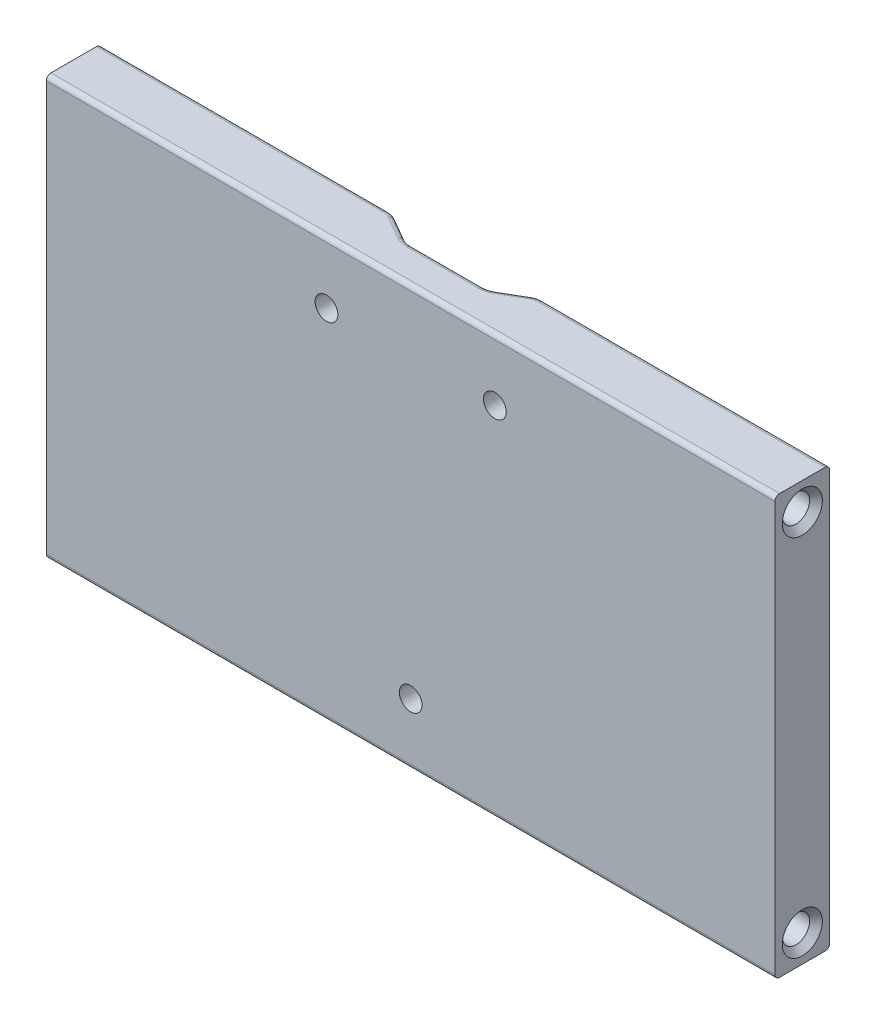
from build123d import *

# Parameters (mm, degrees)
AUFSATZ_LINEAR_AUSTRAGEN1_DEPTH         = 3
AUFSATZ_LINEAR_AUSTRAGEN1_DEPTH_BACK    = 3
SKIZZE1_W                               = 80
SKIZZE1_H                               = 46
F_3_0_3_DURCHMESSER_BOHRUNG1_AT_2_COUNT = 2
F_3_0_3_DURCHMESSER_BOHRUNG1_AT_2_PITCH = 40
SKIZZE4_W                               = 30
SKIZZE4_H                               = 43
SCHNITT_LINEAR_AUSTRAGEN1_DEPTH         = 3
VERRUNDUNG1_R                           = 3
SCHNITT_LINEAR_AUSTRAGEN2_DEPTH         = 1.5
SCHNITT_LINEAR_AUSTRAGEN2_DEPTH_BACK    = 47.238512087
SKIZZE8_R                               = 1.25
SCHNITT_LINEAR_AUSTRAGEN4_DEPTH         = 47.238512087
SCHNITT_LINEAR_AUSTRAGEN5_DEPTH         = 47.238512087
VERRUNDUNG3_R                           = 2
VERRUNDUNG2_R                           = 0.5
FASE1_SIZE                              = 0.7


with BuildPart() as part:
    # Skizze1 → Aufsatz-Linear austragen1 (new, two sides: drawn at the far end of the back side and taken through both)
    with BuildSketch(Plane.XY.offset(-AUFSATZ_LINEAR_AUSTRAGEN1_DEPTH_BACK)):
        Rectangle(SKIZZE1_W, SKIZZE1_H)
    extrude(amount=AUFSATZ_LINEAR_AUSTRAGEN1_DEPTH + AUFSATZ_LINEAR_AUSTRAGEN1_DEPTH_BACK)

    # Skizze2 → Ø3.0 (3) Durchmesser Bohrung1 (revolve, cut)
    with BuildSketch(Plane(origin=(40, -20, 0), x_dir=(0, 0, -1), z_dir=(0, 1, 0))):
        Polygon((0, 0), (0, 10.901290929), (1.5, 10), (1.5, 0), align=None)
    f_3_0_3_durchmesser_bohrung1 = revolve(axis=Axis((46.35, -20, 0), (-1, 0, 0)), mode=Mode.SUBTRACT)

    # Ø3.0 (3) Durchmesser Bohrung1 at 2: Ø3.0 (3) Durchmesser Bohrung1 ×2
    with Locations(*[(0, i * F_3_0_3_DURCHMESSER_BOHRUNG1_AT_2_PITCH, 0) for i in range(1, F_3_0_3_DURCHMESSER_BOHRUNG1_AT_2_COUNT)]):
        add(f_3_0_3_durchmesser_bohrung1, mode=Mode.SUBTRACT)

    # Spiegeln1: Ø3.0 (3) Durchmesser Bohrung1 across plane
    add(f_3_0_3_durchmesser_bohrung1.mirror(Plane(origin=(0, 0, 0), x_dir=(0, 0, 1), z_dir=(1, 0, 0))), mode=Mode.SUBTRACT)

    # Spiegeln1 copy 1 sketch → Spiegeln1 copy 1 (revolve, cut)
    with BuildSketch(Plane(origin=(-40, 20, 0), x_dir=(0, 0, -1), z_dir=(0, 1, 0))):
        Polygon((0, 0), (0, -10.901290929), (1.5, -10), (1.5, 0), align=None)
    revolve(axis=Axis((-46.35, 20, 0), (-1, 0, 0)), mode=Mode.SUBTRACT)

    # Skizze4 → Schnitt-Linear austragen1 (cut)
    with BuildSketch(Plane.XY.offset(-3)):
        Rectangle(SKIZZE4_W, SKIZZE4_H)
    extrude(amount=SCHNITT_LINEAR_AUSTRAGEN1_DEPTH, mode=Mode.SUBTRACT)

    # Verrundung1
    verrundung1_edges = [part.edges().sort_by_distance(p)[0] for p in [
        (15, 21.5, -1.5),
        (-15, 21.5, -1.5),
        (-15, -21.5, -1.5),
        (15, -21.5, -1.5),
    ]]
    fillet(verrundung1_edges, radius=VERRUNDUNG1_R)

    # Skizze5 → Schnitt-Linear austragen2 (cut, two sides: drawn at the far end of the back side and taken through both)
    with BuildSketch(Plane.XY.offset(-SCHNITT_LINEAR_AUSTRAGEN2_DEPTH_BACK)):
        with BuildLine():
            Line((37, -14.5), (37, 14.5))
            ThreePointArc((37, 14.5), (36.121320344, 16.621320344), (34, 17.5))
            Line((34, 17.5), (21, 17.5))
            ThreePointArc((21, 17.5), (18.878679656, 16.621320344), (18, 14.5))
            Line((18, 14.5), (18, -14.5))
            ThreePointArc((18, -14.5), (18.878679656, -16.621320344), (21, -17.5))
            Line((21, -17.5), (34, -17.5))
            ThreePointArc((34, -17.5), (36.121320344, -16.621320344), (37, -14.5))
        make_face()
        with BuildLine():
            Line((-34, -17.5), (-21, -17.5))
            ThreePointArc((-21, -17.5), (-18.878679656, -16.621320344), (-18, -14.5))
            Line((-18, -14.5), (-18, 14.5))
            ThreePointArc((-18, 14.5), (-18.878679656, 16.621320344), (-21, 17.5))
            Line((-21, 17.5), (-34, 17.5))
            ThreePointArc((-34, 17.5), (-36.121320344, 16.621320344), (-37, 14.5))
            Line((-37, 14.5), (-37, -14.5))
            ThreePointArc((-37, -14.5), (-36.121320344, -16.621320344), (-34, -17.5))
        make_face()
    extrude(amount=SCHNITT_LINEAR_AUSTRAGEN2_DEPTH + SCHNITT_LINEAR_AUSTRAGEN2_DEPTH_BACK, mode=Mode.SUBTRACT)

    # Skizze8 → Schnitt-Linear austragen4 (cut, through all)
    with BuildSketch(Plane(origin=(0, 0, 0), x_dir=(-1, 0, 0), z_dir=(0, 0, -1))):
        with Locations((0, -16.255)):
            Circle(SKIZZE8_R)
        with Locations((9.245, 16.255)):
            Circle(SKIZZE8_R)
        with Locations(Location((-9.245, 16.255, 0), (0, 0, 180))):
            Circle(SKIZZE8_R)
    extrude(amount=-SCHNITT_LINEAR_AUSTRAGEN4_DEPTH, mode=Mode.SUBTRACT)

    # Skizze9 → Schnitt-Linear austragen5 (cut, through all)
    with BuildSketch(Plane(origin=(0, 0, 0), x_dir=(1, 0, 0), z_dir=(0, 1, 0))):
        Polygon((7.964101615, 3), (-7.964101615, 3), (-4.5, 1), (4.5, 1), align=None)
    extrude(amount=SCHNITT_LINEAR_AUSTRAGEN5_DEPTH, mode=Mode.SUBTRACT)

    # Verrundung3
    verrundung3_edges = [part.edges().sort_by_distance(p)[0] for p in [
        (-7.964101615, 22.25, -3),
        (-4.5, 22.25, -1),
        (4.5, 22.25, -1),
        (7.964101615, 22.25, -3),
    ]]
    fillet(verrundung3_edges, radius=VERRUNDUNG3_R)

    # Verrundung2
    verrundung2_edges = [part.edges().sort_by_distance(p)[0] for p in [
        (0, -23, -3),
        (27.5, -17.5, -3),
        (36.121320344, -16.621320344, 1.5),
        (37, 0, 1.5),
        (36.121320344, 16.621320344, 1.5),
        (27.5, 17.5, 1.5),
        (18.878679656, 16.621320344, 1.5),
        (18, 0, 1.5),
        (18.878679656, -16.621320344, 1.5),
        (27.5, -17.5, 1.5),
        (0, 23, 3),
        (0, -23, 3),
        (6.232050808, 23, -2),
        (6.232050808, 21.5, -2),
        (-10.25, 21.5, -3),
        (-6.232050808, 21.5, -2),
        (0, 21.5, -1),
        (-7.98236191, 21.5, -2.931851653),
        (7.98236191, 21.5, -2.931851653),
        (-24.25, 23, -3),
        (0, 23, -1),
        (-6.232050808, 23, -2),
        (-7.98236191, 23, -2.931851653),
        (7.98236191, 23, -2.931851653),
        (4.481739705, 21.5, -1.068148347),
        (4.481739705, 23, -1.068148347),
        (-4.481739705, 21.5, -1.068148347),
        (-4.481739705, 23, -1.068148347),
        (24.25, 23, -3),
        (-15, 0, -3),
        (-15, 0, 0),
        (0, -21.5, -3),
        (0, -21.5, 0),
        (0, 21.5, 0),
        (15, 0, 0),
        (14.121320344, 20.621320344, 0),
        (-14.121320344, 20.621320344, 0),
        (14.121320344, -20.621320344, 0),
        (-14.121320344, -20.621320344, 0),
        (15, 0, -3),
        (10.25, 21.5, -3),
        (-14.121320344, -20.621320344, -3),
        (14.121320344, -20.621320344, -3),
        (-14.121320344, 20.621320344, -3),
        (14.121320344, 20.621320344, -3),
        (-18.878679656, 16.621320344, -3),
        (-27.5, 17.5, -3),
        (-36.121320344, 16.621320344, -3),
        (-37, 0, -3),
        (-36.121320344, -16.621320344, -3),
        (-27.5, -17.5, -3),
        (-18.878679656, -16.621320344, -3),
        (-18, 0, -3),
        (-18.878679656, 16.621320344, 1.5),
        (-27.5, 17.5, 1.5),
        (-36.121320344, 16.621320344, 1.5),
        (-37, 0, 1.5),
        (-36.121320344, -16.621320344, 1.5),
        (-27.5, -17.5, 1.5),
        (-18.878679656, -16.621320344, 1.5),
        (-18, 0, 1.5),
        (36.121320344, -16.621320344, -3),
        (37, 0, -3),
        (36.121320344, 16.621320344, -3),
        (27.5, 17.5, -3),
        (18.878679656, 16.621320344, -3),
        (18, 0, -3),
        (18.878679656, -16.621320344, -3),
    ]]
    fillet(verrundung2_edges, radius=VERRUNDUNG2_R - 0.0001)  # a hair under: the kernel refuses the full size

    # Fase1
    fase1_edges = [part.edges().sort_by_distance(p)[0] for p in [
        (40, 20, 1.5),
        (40, -20, 1.5),
        (-40, 20, 1.5),
        (-40, -20, 1.5),
    ]]
    chamfer(fase1_edges, length=FASE1_SIZE)


solid = part.part
